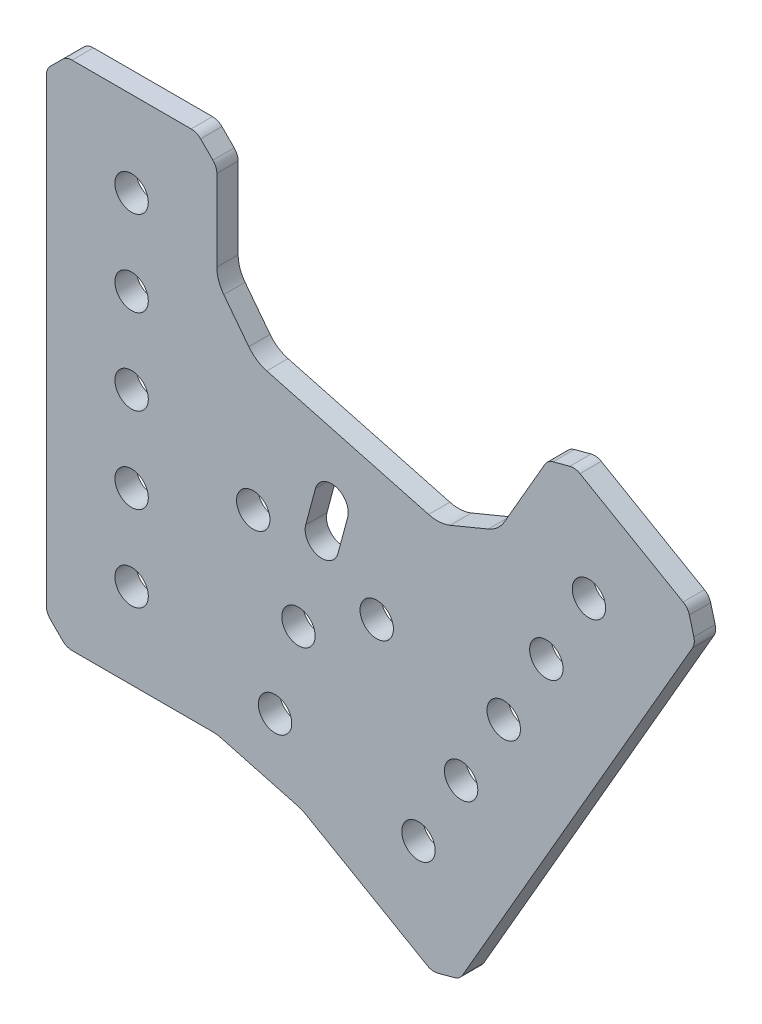
from build123d import *

# Parameters (mm, degrees)
SKETCH1_R           = 2.4892
BOSS_EXTRUDE1_DEPTH = 3.175


with BuildPart() as part:
    # Sketch1 → Boss-Extrude1 (new body)
    with BuildSketch(Plane(origin=(0, 0, 0), x_dir=(-1, 0, 0), z_dir=(0, 0, -1))):
        with BuildLine():
            Line((-2.414213562, 0.585786438), (-0.585786438, 2.414213562))
            ThreePointArc((-0.585786438, 2.414213562), (-0.152240935, 3.06306026), (0, 3.828427125))
            Line((0, 3.828427125), (0, 72.371572875))
            ThreePointArc((0, 72.371572875), (-0.152240935, 73.13693974), (-0.585786438, 73.785786438))
            Line((-0.585786438, 73.785786438), (-2.414213562, 75.614213562))
            ThreePointArc((-2.414213562, 75.614213562), (-3.06306026, 76.047759065), (-3.828427125, 76.2))
            Line((-3.828427125, 76.2), (-21.571572875, 76.2))
            ThreePointArc((-21.571572875, 76.2), (-22.33693974, 76.047759065), (-22.985786438, 75.614213562))
            Line((-22.985786438, 75.614213562), (-24.814213562, 73.785786438))
            ThreePointArc((-24.814213562, 73.785786438), (-25.247759065, 73.13693974), (-25.4, 72.371572875))
            Line((-25.4, 72.371572875), (-25.4, 60.289301259))
            ThreePointArc((-25.4, 60.289301259), (-25.665349353, 58.682103933), (-26.433233299, 57.245494114))
            Line((-26.433233299, 57.245494114), (-30.162321659, 52.385651545))
            ThreePointArc((-30.162321659, 52.385651545), (-31.351237196, 51.272110628), (-32.834993135, 50.599829559))
            Line((-32.834993135, 50.599829559), (-56.961021847, 44.135279649))
            ThreePointArc((-56.961021847, 44.135279649), (-58.582132719, 43.975614164), (-60.168534235, 44.345511117))
            Line((-60.168534235, 44.345511117), (-65.827940772, 46.68971406))
            ThreePointArc((-65.827940772, 46.68971406), (-67.211252686, 47.549912686), (-68.24465063, 48.809111723))
            Line((-68.24465063, 48.809111723), (-74.285786438, 59.272665878))
            ThreePointArc((-74.285786438, 59.272665878), (-74.800314387, 59.859372559), (-75.500199155, 60.204517531))
            Line((-75.500199155, 60.204517531), (-77.997877056, 60.873768307))
            ThreePointArc((-77.997877056, 60.873768307), (-78.776567531, 60.924806377), (-79.515515147, 60.673967462))
            Line((-79.515515147, 60.673967462), (-94.88153011, 51.802394587))
            ThreePointArc((-94.88153011, 51.802394587), (-95.46823679, 51.287866637), (-95.813381762, 50.58798187))
            Line((-95.813381762, 50.58798187), (-96.482632539, 48.090303968))
            ThreePointArc((-96.482632539, 48.090303968), (-96.533670609, 47.311613493), (-96.282831694, 46.572665878))
            Line((-96.282831694, 46.572665878), (-62.011258818, -12.787439597))
            ThreePointArc((-62.011258818, -12.787439597), (-61.496730869, -13.374146278), (-60.796846101, -13.71929125))
            Line((-60.796846101, -13.71929125), (-58.2991682, -14.388542027))
            ThreePointArc((-58.2991682, -14.388542027), (-57.520477725, -14.439580097), (-56.78153011, -14.188741182))
            Line((-56.78153011, -14.188741182), (-38.670072037, -3.732085988))
            ThreePointArc((-38.670072037, -3.732085988), (-38.083489199, -3.442815344), (-37.464167262, -3.232583875))
            Line((-37.464167262, -3.232583875), (-26.035832738, -0.170370869))
            ThreePointArc((-26.035832738, -0.170370869), (-25.394368473, -0.042775693), (-24.741737512, 0))
            Line((-24.741737512, 0), (-3.828427125, 0))
            ThreePointArc((-3.828427125, 0), (-3.06306026, 0.152240935), (-2.414213562, 0.585786438))
        make_face()
        with Locations((-12.7, 25.4)):
            Circle(SKETCH1_R, mode=Mode.SUBTRACT)
        with Locations((-61.798522628, 12.244090512)):
            Circle(SKETCH1_R, mode=Mode.SUBTRACT)
        with Locations((-74.498522628, 34.241135768)):
            Circle(SKETCH1_R, mode=Mode.SUBTRACT)
        with Locations((-12.7, 50.8)):
            Circle(SKETCH1_R, mode=Mode.SUBTRACT)
        with Locations((-80.848522628, 45.239658396)):
            Circle(SKETCH1_R, mode=Mode.SUBTRACT)
        with Locations((-68.148522628, 23.24261314)):
            Circle(SKETCH1_R, mode=Mode.SUBTRACT)
        with Locations((-55.448522628, 1.245567884)):
            Circle(SKETCH1_R, mode=Mode.SUBTRACT)
        with Locations((-12.7, 63.5)):
            Circle(SKETCH1_R, mode=Mode.SUBTRACT)
        with Locations((-12.7, 38.1)):
            Circle(SKETCH1_R, mode=Mode.SUBTRACT)
        with Locations((-12.7, 12.7)):
            Circle(SKETCH1_R, mode=Mode.SUBTRACT)
        with Locations((-30.825461194, 31.649870813)):
            Circle(SKETCH1_R, mode=Mode.SUBTRACT)
        with Locations((-49.226348185, 26.719368004)):
            Circle(SKETCH1_R, mode=Mode.SUBTRACT)
        with Locations((-37.560653285, 19.984175913)):
            Circle(SKETCH1_R, mode=Mode.SUBTRACT)
        with Locations((-34.074261314, 6.972783942)):
            Circle(SKETCH1_R, mode=Mode.SUBTRACT)
        with BuildLine():
            Line((-43.451427823, 32.351315517), (-44.895538661, 37.740810537))
            ThreePointArc((-44.895538661, 37.740810537), (-43.135408461, 40.789445471), (-40.086773527, 39.029315271))
            Line((-40.086773527, 39.029315271), (-38.642662689, 33.639820251))
            ThreePointArc((-38.642662689, 33.639820251), (-40.402792889, 30.591185317), (-43.451427823, 32.351315517))
        make_face(mode=Mode.SUBTRACT)
    extrude(amount=-BOSS_EXTRUDE1_DEPTH)


solid = part.part
